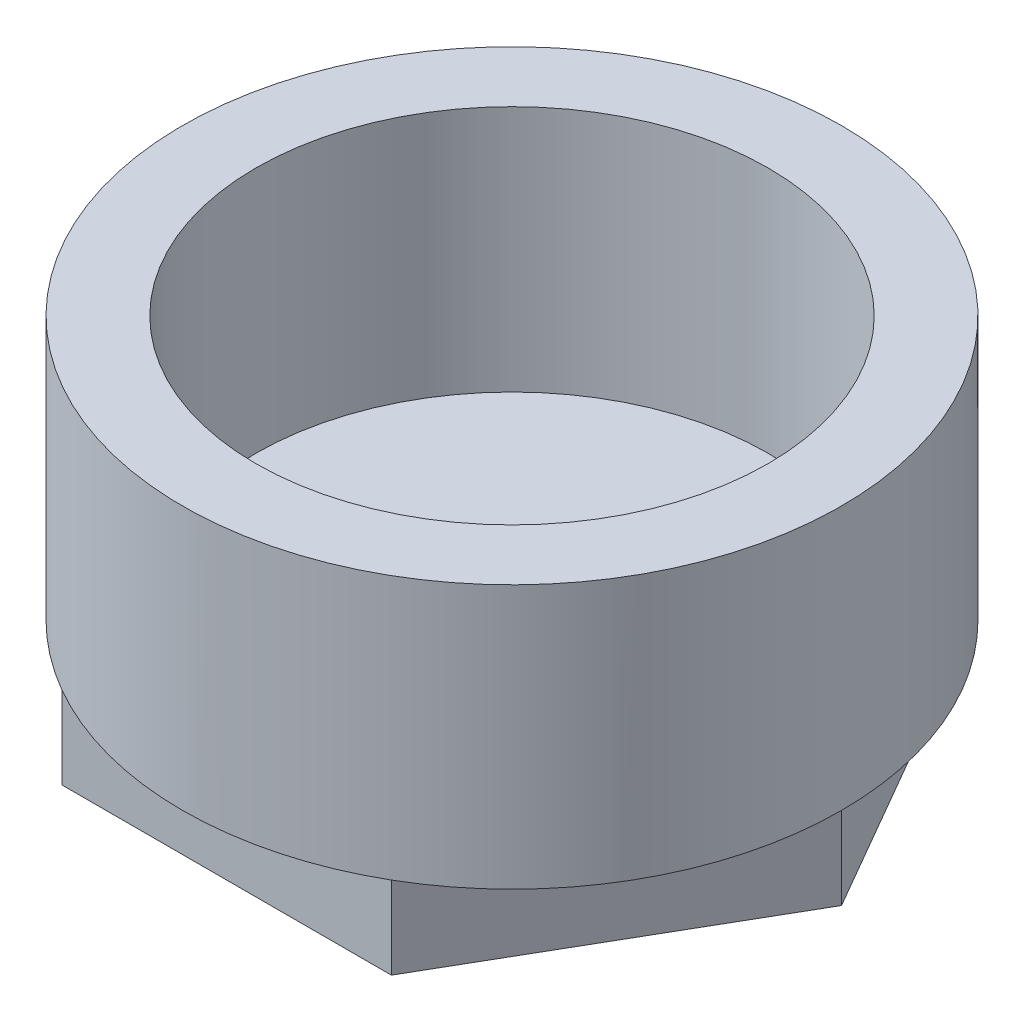
from build123d import *

# Parameters (mm, degrees)
SCHIZZO2_R               = 3.175
SCHIZZO2_R_2             = 0.5
TAGLIO_ESTRUSIONE1_DEPTH = 10
TAGLIO_ESTRUSIONE2_START = -5
TAGLIO_ESTRUSIONE2_DEPTH = 5


with BuildPart() as part:
    # Schizzo1 → Rivoluzione1 (revolve)
    with BuildSketch(Plane.XY):
        Polygon((0, 0), (-20, 0), (-20, 21), (-15.5465, 21), (-15.5465, 6), (0, 6), align=None)
    revolve(axis=Axis((0, 0, 0), (0, 1, 0)))

    # Schizzo2 → Taglio-Estrusione1 (cut)
    with BuildSketch(Plane.XZ):
        Circle(SCHIZZO2_R)
        with Locations((10, 0)):
            Circle(SCHIZZO2_R_2)
    extrude(amount=-TAGLIO_ESTRUSIONE1_DEPTH, mode=Mode.SUBTRACT)

    # Schizzo5 → Taglio-Estrusione2 (cut)
    with BuildSketch(Plane(origin=(0, 0, 0), x_dir=(-1, 0, 0), z_dir=(0, -1, 0)).offset(TAGLIO_ESTRUSIONE2_START)):
        with BuildLine():
            ThreePointArc((20, 0), (17.320508076, 10), (10, 17.320508076))
            Line((10, 17.320508076), (20, 0))
        make_face()
        with BuildLine():
            Line((-10, 17.320508076), (10, 17.320508076))
            ThreePointArc((10, 17.320508076), (0, 20), (-10, 17.320508076))
        make_face()
        with BuildLine():
            ThreePointArc((10, -17.320508076), (17.320508076, -10), (20, 0))
            Line((20, 0), (10, -17.320508076))
        make_face()
        with BuildLine():
            Line((-20, 0), (-10, 17.320508076))
            ThreePointArc((-10, 17.320508076), (-17.320508076, 10), (-20, 0))
        make_face()
        with BuildLine():
            ThreePointArc((-10, -17.320508076), (0, -20), (10, -17.320508076))
            Line((10, -17.320508076), (-10, -17.320508076))
        make_face()
        with BuildLine():
            Line((-10, -17.320508076), (-20, 0))
            ThreePointArc((-20, 0), (-17.320508076, -10), (-10, -17.320508076))
        make_face()
    extrude(amount=TAGLIO_ESTRUSIONE2_DEPTH, mode=Mode.SUBTRACT)


solid = part.part
